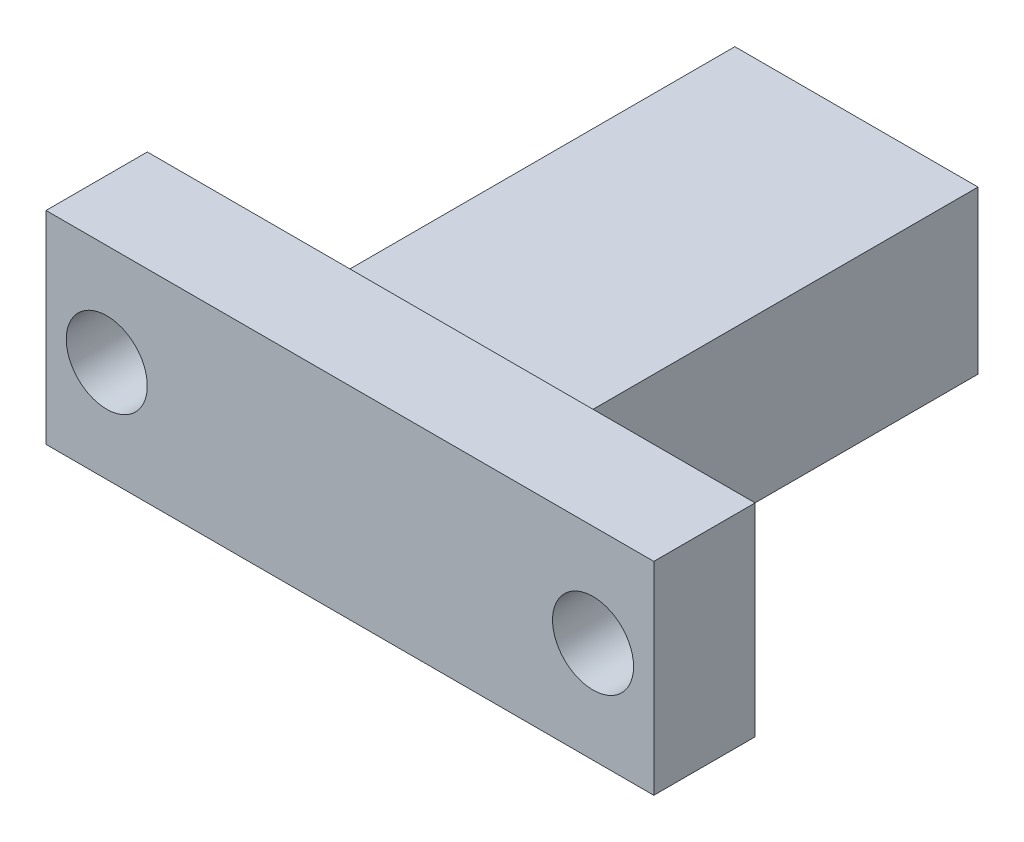
from build123d import *

# Parameters (mm, degrees)
SKETCH1_W           = 30
SKETCH1_H           = 10
SKETCH1_R           = 2
BOSS_EXTRUDE1_DEPTH = 5
SKETCH2_W           = 12
SKETCH2_H           = 8
BOSS_EXTRUDE2_DEPTH = 20
SKETCH3_R           = 5
CUT_EXTRUDE1_DEPTH  = 6


with BuildPart() as part:
    # Sketch1 → Boss-Extrude1 (new body)
    with BuildSketch(Plane.XY):
        Rectangle(SKETCH1_W, SKETCH1_H)
        with Locations((12, 0)):
            Circle(SKETCH1_R, mode=Mode.SUBTRACT)
        with Locations((-12, 0)):
            Circle(SKETCH1_R, mode=Mode.SUBTRACT)
    extrude(amount=BOSS_EXTRUDE1_DEPTH)

    # Sketch2 → Boss-Extrude2 (add)
    with BuildSketch(Plane(origin=(0, 0, 0), x_dir=(-1, 0, 0), z_dir=(0, 0, -1))):
        Rectangle(SKETCH2_W, SKETCH2_H)
    extrude(amount=BOSS_EXTRUDE2_DEPTH)

    # Sketch3 → Cut-Extrude1 (cut)
    with BuildSketch(Plane(origin=(-5, -5, 0), x_dir=(-0.7071067811865477, 0.7071067811865475, 0), z_dir=(-0.7071067811865475, -0.7071067811865477, 0))):
        with Locations((1.414213562, 10)):
            Circle(SKETCH3_R)
    extrude(amount=-CUT_EXTRUDE1_DEPTH, mode=Mode.SUBTRACT)


solid = part.part
